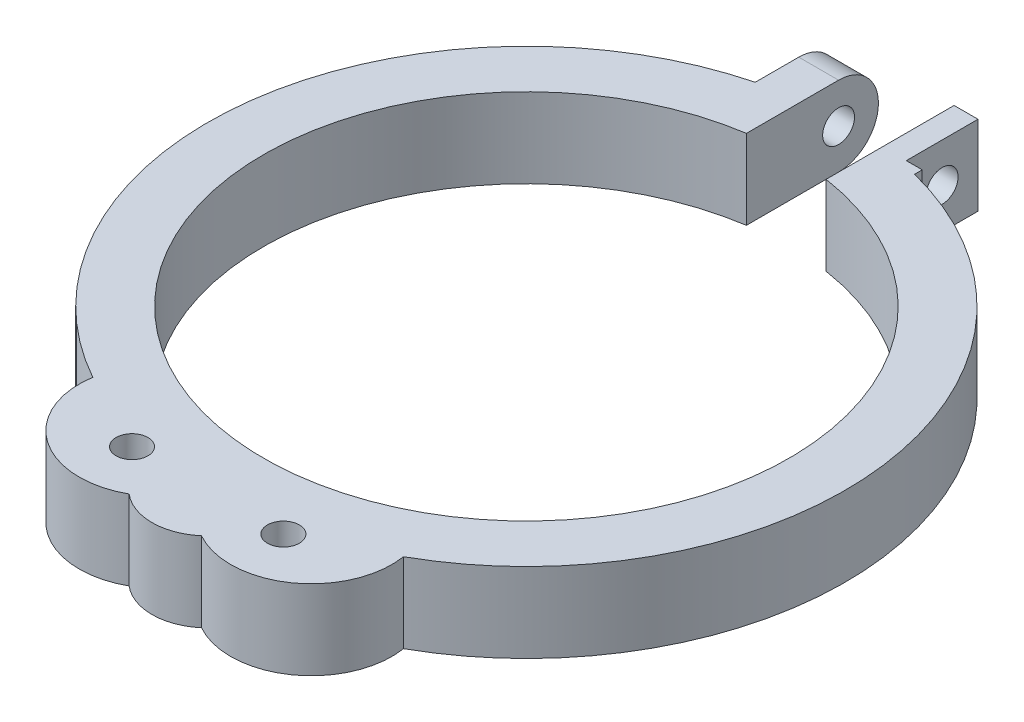
from build123d import *

# Parameters (mm, degrees)
SALIENTE_EXTRUIR1_DEPTH = 10
SALIENTE_EXTRUIR2_START = -10
SALIENTE_EXTRUIR2_DEPTH = 10
CROQUIS3_R              = 2
SALIENTE_EXTRUIR3_DEPTH = 5
CROQUIS5_W              = 9
CROQUIS5_H              = 10
CROQUIS5_R              = 2
SALIENTE_EXTRUIR4_DEPTH = 3
CROQUIS8_R              = 2
CORTAR_EXTRUIR1_DEPTH   = 10


with BuildPart() as part:
    # Croquis1 → Saliente-Extruir1 (new body)
    with BuildSketch(Plane(origin=(0, 0, 0), x_dir=(1, 0, 0), z_dir=(0, 1, 0))):
        with BuildLine():
            Line((5, 39.686269666), (5, 32.619012861))
            ThreePointArc((5, 32.619012861), (0, -33), (-5, 32.619012861))
            Line((-5, 32.619012861), (-5, 39.686269666))
            Line((-5, 39.686269666), (-10, 39.686269666))
            Line((-10, 39.686269666), (-10, 38.729833462))
            ThreePointArc((-10, 38.729833462), (0, -40), (10, 38.729833462))
            Line((10, 38.729833462), (10, 39.686269666))
            Line((10, 39.686269666), (5, 39.686269666))
        make_face()
    extrude(amount=SALIENTE_EXTRUIR1_DEPTH)

    # Croquis2 → Saliente-Extruir2 (add)
    with BuildSketch(Plane(origin=(0, 10, 0), x_dir=(1, 0, 0), z_dir=(0, 1, 0)).offset(SALIENTE_EXTRUIR2_START)):
        with BuildLine():
            ThreePointArc((-19.500878735, -34.924428822), (-15.280033507, -44.812112406), (-4.541463415, -45.326829268))
            ThreePointArc((-4.541463415, -45.326829268), (0, -47), (4.541463415, -45.326829268))
            ThreePointArc((4.541463415, -45.326829268), (15.280033507, -44.812112406), (19.500878735, -34.924428822))
            ThreePointArc((19.500878735, -34.924428822), (0, -40), (-19.500878735, -34.924428822))
        make_face()
    extrude(amount=SALIENTE_EXTRUIR2_DEPTH)

    # Croquis3 → Saliente-Extruir3 (add)
    with BuildSketch(Plane.ZY.offset(10)):
        with BuildLine():
            Line((-39.686269666, 10), (-44.186269666, 10))
            ThreePointArc((-44.186269666, 10), (-49.186269666, 5), (-44.186269666, 0))
            Line((-44.186269666, 0), (-39.686269666, 0))
            Line((-39.686269666, 0), (-39.686269666, 10))
        make_face()
        with Locations((-44.186269666, 5)):
            Circle(CROQUIS3_R, mode=Mode.SUBTRACT)
    extrude(amount=-SALIENTE_EXTRUIR3_DEPTH)

    # Croquis5 → Saliente-Extruir4 (add)
    with BuildSketch(Plane.ZY.offset(-5)):
        with Locations((-44.186269666, 5)):
            Rectangle(CROQUIS5_W, CROQUIS5_H)
        with Locations((-44.186269666, 5)):
            Circle(CROQUIS5_R, mode=Mode.SUBTRACT)
    extrude(amount=-SALIENTE_EXTRUIR4_DEPTH)

    # Croquis8 → Cortar-Extruir1 (cut)
    with BuildSketch(Plane(origin=(0, 10, 0), x_dir=(1, 0, 0), z_dir=(0, 1, 0))):
        with Locations((9.5, -40)):
            Circle(CROQUIS8_R)
        with Locations((-9.5, -40)):
            Circle(CROQUIS8_R)
    extrude(amount=-CORTAR_EXTRUIR1_DEPTH, mode=Mode.SUBTRACT)


solid = part.part
